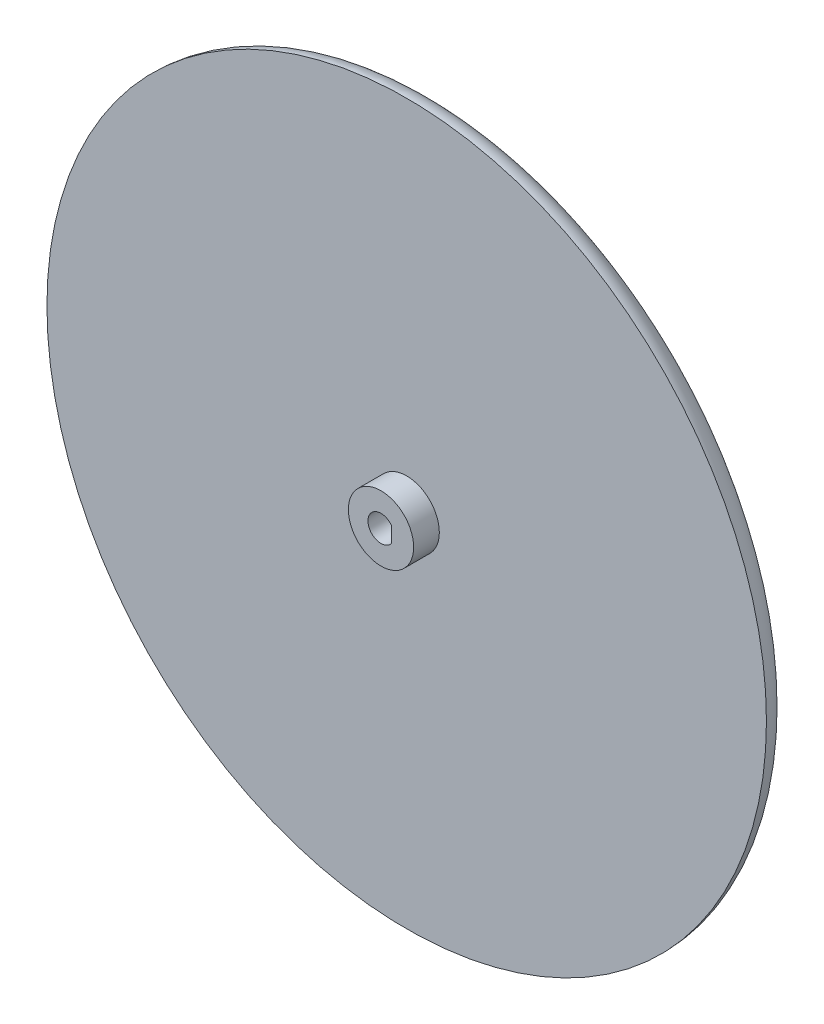
from build123d import *

# Parameters (mm, degrees)
SKETCH3_R           = 6.35
BOSS_EXTRUDE2_DEPTH = 10
CUT_EXTRUDE2_DEPTH  = 10
SKETCH5_R           = 70
BOSS_EXTRUDE3_DEPTH = 5
FILLET1_R           = 5


with BuildPart() as part:
    # Sketch3 → Boss-Extrude2 (new body)
    with BuildSketch(Plane.XY):
        Circle(SKETCH3_R)
    extrude(amount=BOSS_EXTRUDE2_DEPTH)

    # Sketch4 → Cut-Extrude2 (cut)
    with BuildSketch(Plane.XY.offset(10)):
        with BuildLine():
            Line((2.042025903, -1.510539709), (2.042025903, 1.510539709))
            ThreePointArc((2.042025903, 1.510539709), (-2.54, 0), (2.042025903, -1.510539709))
        make_face()
    extrude(amount=-CUT_EXTRUDE2_DEPTH, mode=Mode.SUBTRACT)

    # Sketch5 → Boss-Extrude3 (add)
    with BuildSketch(Plane.XY):
        Circle(SKETCH5_R)
    extrude(amount=BOSS_EXTRUDE3_DEPTH)

    # Fillet1
    fillet1_edges = [part.edges().sort_by_distance(p)[0] for p in [
        (-70, 0, 0),
    ]]
    fillet(fillet1_edges, radius=FILLET1_R - 0.0001)  # a hair under: the kernel refuses the full size


solid = part.part
